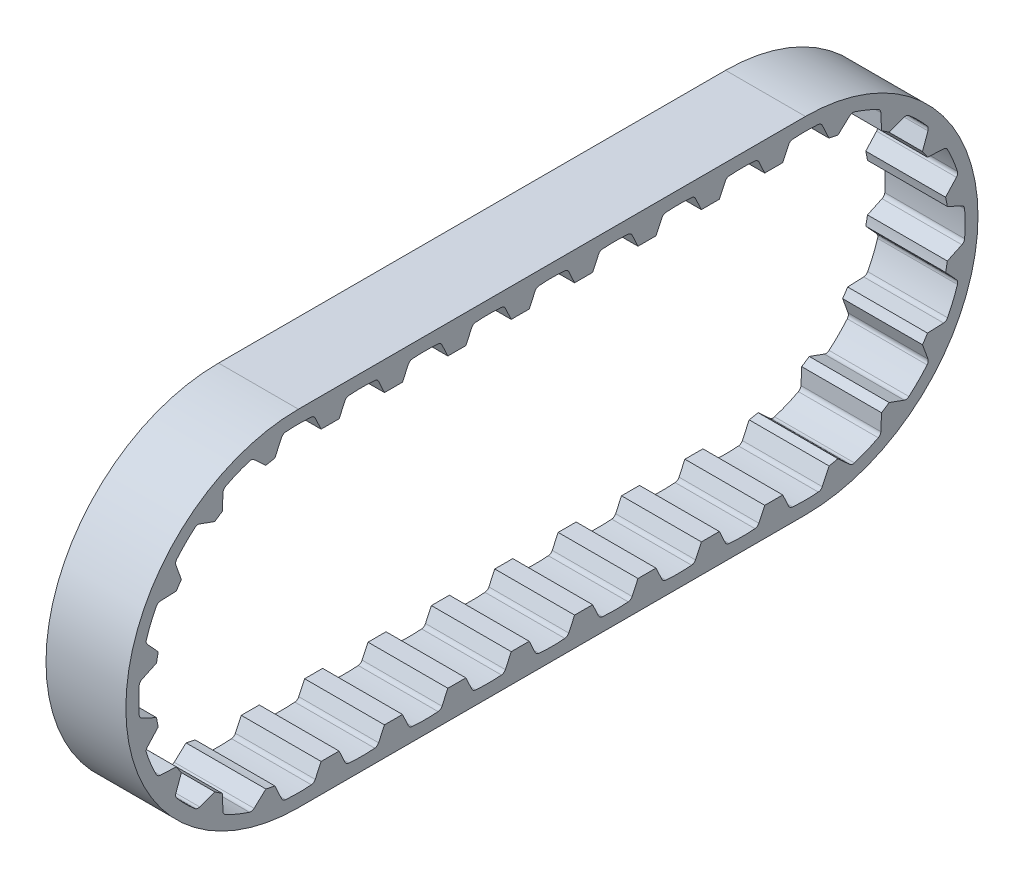
from build123d import *

# Parameters (mm, degrees)
SKETCH_2_W            = 6.4
SKETCH_2_H            = 2.3
CUT_EXTRUDE_1_DEPTH   = 57.290553399
PATTERN_START         = -3.2
PATTERN_CURVE_1_DEPTH = 6.4


# Read off the part's stored shape, not the designer's step: 曲线阵列1
with BuildPart() as part:
    # 扫描1: sweep along a path in 草图1
    with BuildLine(Plane(origin=(0, 0, 0), x_dir=(0, 0, -1), z_dir=(1, 0, 0))) as sweep_1_path:
        Line((0, 13.831), (40.64, 13.831))
        ThreePointArc((40.64, 13.831), (54.471, 0), (40.64, -13.831))
        Line((40.64, -13.831), (0, -13.831))
        ThreePointArc((0, -13.831), (-13.831, 0), (0, 13.831))
    # 草图2 → 扫描1 (sweep)
    with BuildSketch(Plane.XY):
        with Locations((0, 12.681)):
            Rectangle(SKETCH_2_W, SKETCH_2_H)
    sweep(path=sweep_1_path.line)

    # 草图3 → 切除-拉伸1 (cut, symmetric)
    with BuildSketch(Plane(origin=(0, 0, 0), x_dir=(0, 0, -1), z_dir=(1, 0, 0))):
        with BuildLine():
            Line((-12.541026384, 1.347471358), (-7.781, 3.567108114))
            Line((-7.781, 3.567108114), (-7.781, -3.567108114))
            Line((-7.781, -3.567108114), (-12.541026384, -1.347471358))
            ThreePointArc((-12.541026384, -1.347471358), (-12.692407492, -1.220032795), (-12.759190316, -1.033761805))
            ThreePointArc((-12.759190316, -1.033761805), (-12.801, 0), (-12.759190316, 1.033761805))
            ThreePointArc((-12.759190316, 1.033761805), (-12.692407492, 1.220032795), (-12.541026384, 1.347471358))
        make_face()
    extrude(amount=CUT_EXTRUDE_1_DEPTH, both=True, mode=Mode.SUBTRACT)

    # 曲线阵列1 outline → 曲线阵列1 (cut)
    with BuildSketch(Plane.YZ.offset(PATTERN_START)):
        with BuildLine():
            ThreePointArc((6.0443314, 11.07064044), (5.984527751, 11.259267985), (5.837994725, 11.392252569))
            ThreePointArc((5.837994725, 11.392252569), (4.898930567, 11.826499072), (3.927865356, 12.183491895))
            ThreePointArc((3.927865356, 12.183491895), (3.730216882, 12.193078774), (3.55454642, 12.101992463))
            Line((3.55454642, 12.101992463), (2.605846728, 11.232698867))
            ThreePointArc((2.605846728, 11.232698867), (4.41290277, 10.653180283), (6.100436521, 9.78512316))
            Line((6.100436521, 9.78512316), (6.0443314, 11.07064044))
        make_face()
        with BuildLine():
            Line((-6.0443314, 11.07064044), (-6.100436521, 9.78512316))
            ThreePointArc((-6.100436521, 9.78512316), (-4.41290277, 10.653180283), (-2.605846728, 11.232698867))
            Line((-2.605846728, 11.232698867), (-3.55454642, 12.101992463))
            ThreePointArc((-3.55454642, 12.101992463), (-3.730216882, 12.193078774), (-3.927865356, 12.183491895))
            ThreePointArc((-3.927865356, 12.183491895), (-4.898930567, 11.826499072), (-5.837994725, 11.392252569))
            ThreePointArc((-5.837994725, 11.392252569), (-5.984527751, 11.259267985), (-6.0443314, 11.07064044))
        make_face()
        with BuildLine():
            Line((-9.820918564, 7.914706589), (-9.380786329, 6.705580426))
            ThreePointArc((-9.380786329, 6.705580426), (-8.153923993, 8.153372585), (-6.706214806, 9.380332829))
            Line((-6.706214806, 9.380332829), (-7.915370731, 9.820383292))
            ThreePointArc((-7.915370731, 9.820383292), (-8.112526584, 9.837306562), (-8.291459795, 9.752809619))
            ThreePointArc((-8.291459795, 9.752809619), (-9.05197997, 9.051367832), (-9.753370324, 8.290800222))
            ThreePointArc((-9.753370324, 8.290800222), (-9.837855166, 8.111861297), (-9.820918564, 7.914706589))
        make_face()
        with BuildLine():
            Line((-12.102232819, 3.553727989), (-11.232875067, 2.605087087))
            ThreePointArc((-11.232875067, 2.605087087), (-10.65347869, 4.412182317), (-9.785535692, 6.099774768))
            Line((-9.785535692, 6.099774768), (-11.071049175, 6.043582711))
            ThreePointArc((-11.071049175, 6.043582711), (-11.259672676, 5.983766306), (-11.39264735, 5.837224286))
            ThreePointArc((-11.39264735, 5.837224286), (-11.826830346, 4.898130763), (-12.183757497, 3.927041412))
            ThreePointArc((-12.183757497, 3.927041412), (-12.19333101, 3.729392291), (-12.102232819, 3.553727989))
        make_face()
        with BuildLine():
            Line((-12.541026384, -1.348346114), (-11.531, -1.819329152))
            Line((-11.531, -1.819329152), (-11.531, 0))
            ThreePointArc((-11.531, 0), (-11.491933973, 0.948374689), (-11.375000598, 1.890323355))
            Line((-11.375000598, 1.890323355), (-12.541026384, 1.346596601))
            ThreePointArc((-12.541026384, 1.346596601), (-12.692407492, 1.219158038), (-12.759190316, 1.032887048))
            ThreePointArc((-12.759190316, 1.032887048), (-12.801, -0.000874757), (-12.759190316, -1.034636561))
            ThreePointArc((-12.759190316, -1.034636561), (-12.692407492, -1.220907551), (-12.541026384, -1.348346114))
        make_face()
        with BuildLine():
            Line((-12.541026384, -6.428127425), (-11.531, -6.899110463))
            Line((-11.531, -6.899110463), (-11.531, -3.262201672))
            Line((-11.531, -3.262201672), (-12.541026384, -3.73318471))
            ThreePointArc((-12.541026384, -3.73318471), (-12.692407492, -3.860623273), (-12.759190316, -4.046894263))
            ThreePointArc((-12.759190316, -4.046894263), (-12.801, -5.080656067), (-12.759190316, -6.114417872))
            ThreePointArc((-12.759190316, -6.114417872), (-12.692407492, -6.300688862), (-12.541026384, -6.428127425))
        make_face()
        with BuildLine():
            Line((-12.541026384, -11.507908736), (-11.531, -11.978891774))
            Line((-11.531, -11.978891774), (-11.531, -8.341982983))
            Line((-11.531, -8.341982983), (-12.541026384, -8.81296602))
            ThreePointArc((-12.541026384, -8.81296602), (-12.692407492, -8.940404583), (-12.759190316, -9.126675573))
            ThreePointArc((-12.759190316, -9.126675573), (-12.801, -10.160437378), (-12.759190316, -11.194199183))
            ThreePointArc((-12.759190316, -11.194199183), (-12.692407492, -11.380470173), (-12.541026384, -11.507908736))
        make_face()
        with BuildLine():
            Line((-12.541026384, -16.587690047), (-11.531, -17.058673085))
            Line((-11.531, -17.058673085), (-11.531, -13.421764294))
            Line((-11.531, -13.421764294), (-12.541026384, -13.892747331))
            ThreePointArc((-12.541026384, -13.892747331), (-12.692407492, -14.020185894), (-12.759190316, -14.206456884))
            ThreePointArc((-12.759190316, -14.206456884), (-12.801, -15.240218689), (-12.759190316, -16.273980494))
            ThreePointArc((-12.759190316, -16.273980494), (-12.692407492, -16.460251484), (-12.541026384, -16.587690047))
        make_face()
        with BuildLine():
            Line((-12.541026384, -21.667471358), (-11.531, -22.138454396))
            Line((-11.531, -22.138454396), (-11.531, -18.501545604))
            Line((-11.531, -18.501545604), (-12.541026384, -18.972528642))
            ThreePointArc((-12.541026384, -18.972528642), (-12.692407492, -19.099967205), (-12.759190316, -19.286238195))
            ThreePointArc((-12.759190316, -19.286238195), (-12.801, -20.32), (-12.759190316, -21.353761805))
            ThreePointArc((-12.759190316, -21.353761805), (-12.692407492, -21.540032795), (-12.541026384, -21.667471358))
        make_face()
        with BuildLine():
            Line((-12.541026384, -26.747252669), (-11.531, -27.218235706))
            Line((-11.531, -27.218235706), (-11.531, -23.581326915))
            Line((-11.531, -23.581326915), (-12.541026384, -24.052309953))
            ThreePointArc((-12.541026384, -24.052309953), (-12.692407492, -24.179748516), (-12.759190316, -24.366019506))
            ThreePointArc((-12.759190316, -24.366019506), (-12.801, -25.399781311), (-12.759190316, -26.433543116))
            ThreePointArc((-12.759190316, -26.433543116), (-12.692407492, -26.619814106), (-12.541026384, -26.747252669))
        make_face()
        with BuildLine():
            Line((-12.541026384, -31.82703398), (-11.531, -32.298017017))
            Line((-11.531, -32.298017017), (-11.531, -28.661108226))
            Line((-11.531, -28.661108226), (-12.541026384, -29.132091264))
            ThreePointArc((-12.541026384, -29.132091264), (-12.692407492, -29.259529827), (-12.759190316, -29.445800817))
            ThreePointArc((-12.759190316, -29.445800817), (-12.801, -30.479562622), (-12.759190316, -31.513324427))
            ThreePointArc((-12.759190316, -31.513324427), (-12.692407492, -31.699595417), (-12.541026384, -31.82703398))
        make_face()
        with BuildLine():
            Line((-12.541026384, -36.90681529), (-11.531, -37.377798328))
            Line((-11.531, -37.377798328), (-11.531, -33.740889537))
            Line((-11.531, -33.740889537), (-12.541026384, -34.211872575))
            ThreePointArc((-12.541026384, -34.211872575), (-12.692407492, -34.339311138), (-12.759190316, -34.525582128))
            ThreePointArc((-12.759190316, -34.525582128), (-12.801, -35.559343932), (-12.759190316, -36.593105737))
            ThreePointArc((-12.759190316, -36.593105737), (-12.692407492, -36.779376727), (-12.541026384, -36.90681529))
        make_face()
        with BuildLine():
            Line((-12.541026384, -41.986596601), (-11.375000598, -42.530323355))
            ThreePointArc((-11.375000598, -42.530323355), (-11.491933973, -41.588374689), (-11.531, -40.64))
            Line((-11.531, -40.64), (-11.531, -38.820670848))
            Line((-11.531, -38.820670848), (-12.541026384, -39.291653886))
            ThreePointArc((-12.541026384, -39.291653886), (-12.692407492, -39.419092449), (-12.759190316, -39.605363439))
            ThreePointArc((-12.759190316, -39.605363439), (-12.801, -40.639125243), (-12.759190316, -41.672887048))
            ThreePointArc((-12.759190316, -41.672887048), (-12.692407492, -41.859158038), (-12.541026384, -41.986596601))
        make_face()
        with BuildLine():
            Line((-11.071049175, -46.683582711), (-9.785535692, -46.739774768))
            ThreePointArc((-9.785535692, -46.739774768), (-10.65347869, -45.052182317), (-11.232875067, -43.245087087))
            Line((-11.232875067, -43.245087087), (-12.102232819, -44.193727989))
            ThreePointArc((-12.102232819, -44.193727989), (-12.19333101, -44.369392291), (-12.183757497, -44.567041412))
            ThreePointArc((-12.183757497, -44.567041412), (-11.826830346, -45.538130763), (-11.39264735, -46.477224286))
            ThreePointArc((-11.39264735, -46.477224286), (-11.259672676, -46.623766306), (-11.071049175, -46.683582711))
        make_face()
        with BuildLine():
            Line((-7.915370731, -50.460383292), (-6.706214806, -50.020332829))
            ThreePointArc((-6.706214806, -50.020332829), (-8.153923993, -48.793372586), (-9.380786329, -47.345580426))
            Line((-9.380786329, -47.345580426), (-9.820918564, -48.554706589))
            ThreePointArc((-9.820918564, -48.554706589), (-9.837855166, -48.751861297), (-9.753370324, -48.930800222))
            ThreePointArc((-9.753370324, -48.930800222), (-9.05197997, -49.691367832), (-8.291459795, -50.392809619))
            ThreePointArc((-8.291459795, -50.392809619), (-8.112526584, -50.477306562), (-7.915370731, -50.460383292))
        make_face()
        with BuildLine():
            Line((-3.55454642, -52.741992463), (-2.605846728, -51.872698867))
            ThreePointArc((-2.605846728, -51.872698867), (-4.41290277, -51.293180283), (-6.100436521, -50.42512316))
            Line((-6.100436521, -50.42512316), (-6.0443314, -51.71064044))
            ThreePointArc((-6.0443314, -51.71064044), (-5.984527751, -51.899267985), (-5.837994725, -52.032252569))
            ThreePointArc((-5.837994725, -52.032252569), (-4.898930567, -52.466499072), (-3.927865356, -52.823491895))
            ThreePointArc((-3.927865356, -52.823491895), (-3.730216882, -52.833078774), (-3.55454642, -52.741992463))
        make_face()
        with BuildLine():
            Line((1.347471358, -53.181026384), (1.891271613, -52.014842974))
            ThreePointArc((1.891271613, -52.014842974), (0, -52.171), (-1.891271613, -52.014842974))
            Line((-1.891271613, -52.014842974), (-1.347471358, -53.181026384))
            ThreePointArc((-1.347471358, -53.181026384), (-1.220032795, -53.332407492), (-1.033761805, -53.399190316))
            ThreePointArc((-1.033761805, -53.399190316), (0, -53.441), (1.033761805, -53.399190316))
            ThreePointArc((1.033761805, -53.399190316), (1.220032795, -53.332407492), (1.347471358, -53.181026384))
        make_face()
        with BuildLine():
            Line((6.0443314, -51.71064044), (6.100436521, -50.42512316))
            ThreePointArc((6.100436521, -50.42512316), (4.41290277, -51.293180283), (2.605846728, -51.872698867))
            Line((2.605846728, -51.872698867), (3.55454642, -52.741992463))
            ThreePointArc((3.55454642, -52.741992463), (3.730216882, -52.833078774), (3.927865356, -52.823491895))
            ThreePointArc((3.927865356, -52.823491895), (4.898930567, -52.466499072), (5.837994725, -52.032252569))
            ThreePointArc((5.837994725, -52.032252569), (5.984527751, -51.899267985), (6.0443314, -51.71064044))
        make_face()
        with BuildLine():
            Line((9.820918564, -48.554706589), (9.380786329, -47.345580426))
            ThreePointArc((9.380786329, -47.345580426), (8.153923993, -48.793372586), (6.706214806, -50.020332829))
            Line((6.706214806, -50.020332829), (7.915370731, -50.460383292))
            ThreePointArc((7.915370731, -50.460383292), (8.112526584, -50.477306562), (8.291459795, -50.392809619))
            ThreePointArc((8.291459795, -50.392809619), (9.05197997, -49.691367832), (9.753370324, -48.930800222))
            ThreePointArc((9.753370324, -48.930800222), (9.837855166, -48.751861297), (9.820918564, -48.554706589))
        make_face()
        with BuildLine():
            Line((12.102232819, -44.193727989), (11.232875067, -43.245087087))
            ThreePointArc((11.232875067, -43.245087087), (10.65347869, -45.052182317), (9.785535692, -46.739774768))
            Line((9.785535692, -46.739774768), (11.071049175, -46.683582711))
            ThreePointArc((11.071049175, -46.683582711), (11.259672676, -46.623766306), (11.39264735, -46.477224286))
            ThreePointArc((11.39264735, -46.477224286), (11.826830346, -45.538130763), (12.183757497, -44.567041412))
            ThreePointArc((12.183757497, -44.567041412), (12.19333101, -44.369392291), (12.102232819, -44.193727989))
        make_face()
        with BuildLine():
            Line((12.541026384, -39.291653886), (11.531, -38.820670848))
            Line((11.531, -38.820670848), (11.531, -40.64))
            ThreePointArc((11.531, -40.64), (11.491933973, -41.588374689), (11.375000598, -42.530323355))
            Line((11.375000598, -42.530323355), (12.541026384, -41.986596601))
            ThreePointArc((12.541026384, -41.986596601), (12.692407492, -41.859158038), (12.759190316, -41.672887048))
            ThreePointArc((12.759190316, -41.672887048), (12.801, -40.639125244), (12.759190316, -39.605363439))
            ThreePointArc((12.759190316, -39.605363439), (12.692407492, -39.419092449), (12.541026384, -39.291653886))
        make_face()
        with BuildLine():
            Line((12.541026384, -34.211872575), (11.531, -33.740889537))
            Line((11.531, -33.740889537), (11.531, -37.377798328))
            Line((11.531, -37.377798328), (12.541026384, -36.90681529))
            ThreePointArc((12.541026384, -36.90681529), (12.692407492, -36.779376727), (12.759190316, -36.593105737))
            ThreePointArc((12.759190316, -36.593105737), (12.801, -35.559343933), (12.759190316, -34.525582128))
            ThreePointArc((12.759190316, -34.525582128), (12.692407492, -34.339311138), (12.541026384, -34.211872575))
        make_face()
        with BuildLine():
            Line((12.541026384, -29.132091264), (11.531, -28.661108226))
            Line((11.531, -28.661108226), (11.531, -32.298017017))
            Line((11.531, -32.298017017), (12.541026384, -31.82703398))
            ThreePointArc((12.541026384, -31.82703398), (12.692407492, -31.699595417), (12.759190316, -31.513324427))
            ThreePointArc((12.759190316, -31.513324427), (12.801, -30.479562622), (12.759190316, -29.445800817))
            ThreePointArc((12.759190316, -29.445800817), (12.692407492, -29.259529827), (12.541026384, -29.132091264))
        make_face()
        with BuildLine():
            Line((12.541026384, -24.052309953), (11.531, -23.581326915))
            Line((11.531, -23.581326915), (11.531, -27.218235706))
            Line((11.531, -27.218235706), (12.541026384, -26.747252669))
            ThreePointArc((12.541026384, -26.747252669), (12.692407492, -26.619814106), (12.759190316, -26.433543116))
            ThreePointArc((12.759190316, -26.433543116), (12.801, -25.399781311), (12.759190316, -24.366019506))
            ThreePointArc((12.759190316, -24.366019506), (12.692407492, -24.179748516), (12.541026384, -24.052309953))
        make_face()
        with BuildLine():
            Line((12.541026384, -18.972528642), (11.531, -18.501545604))
            Line((11.531, -18.501545604), (11.531, -22.138454396))
            Line((11.531, -22.138454396), (12.541026384, -21.667471358))
            ThreePointArc((12.541026384, -21.667471358), (12.692407492, -21.540032795), (12.759190316, -21.353761805))
            ThreePointArc((12.759190316, -21.353761805), (12.801, -20.32), (12.759190316, -19.286238195))
            ThreePointArc((12.759190316, -19.286238195), (12.692407492, -19.099967205), (12.541026384, -18.972528642))
        make_face()
        with BuildLine():
            Line((12.541026384, -13.892747331), (11.531, -13.421764294))
            Line((11.531, -13.421764294), (11.531, -17.058673085))
            Line((11.531, -17.058673085), (12.541026384, -16.587690047))
            ThreePointArc((12.541026384, -16.587690047), (12.692407492, -16.460251484), (12.759190316, -16.273980494))
            ThreePointArc((12.759190316, -16.273980494), (12.801, -15.240218689), (12.759190316, -14.206456884))
            ThreePointArc((12.759190316, -14.206456884), (12.692407492, -14.020185894), (12.541026384, -13.892747331))
        make_face()
        with BuildLine():
            Line((12.541026384, -8.81296602), (11.531, -8.341982983))
            Line((11.531, -8.341982983), (11.531, -11.978891774))
            Line((11.531, -11.978891774), (12.541026384, -11.507908736))
            ThreePointArc((12.541026384, -11.507908736), (12.692407492, -11.380470173), (12.759190316, -11.194199183))
            ThreePointArc((12.759190316, -11.194199183), (12.801, -10.160437378), (12.759190316, -9.126675573))
            ThreePointArc((12.759190316, -9.126675573), (12.692407492, -8.940404583), (12.541026384, -8.81296602))
        make_face()
        with BuildLine():
            Line((12.541026384, -3.73318471), (11.531, -3.262201672))
            Line((11.531, -3.262201672), (11.531, -6.899110463))
            Line((11.531, -6.899110463), (12.541026384, -6.428127425))
            ThreePointArc((12.541026384, -6.428127425), (12.692407492, -6.300688862), (12.759190316, -6.114417872))
            ThreePointArc((12.759190316, -6.114417872), (12.801, -5.080656067), (12.759190316, -4.046894263))
            ThreePointArc((12.759190316, -4.046894263), (12.692407492, -3.860623273), (12.541026384, -3.73318471))
        make_face()
        with BuildLine():
            Line((12.541026384, 1.346596601), (11.375000598, 1.890323355))
            ThreePointArc((11.375000598, 1.890323355), (11.491933973, 0.948374689), (11.531, 0))
            Line((11.531, 0), (11.531, -1.819329152))
            Line((11.531, -1.819329152), (12.541026384, -1.348346114))
            ThreePointArc((12.541026384, -1.348346114), (12.692407492, -1.220907551), (12.759190316, -1.034636561))
            ThreePointArc((12.759190316, -1.034636561), (12.801, -0.000874756), (12.759190316, 1.032887048))
            ThreePointArc((12.759190316, 1.032887048), (12.692407492, 1.219158038), (12.541026384, 1.346596601))
        make_face()
        with BuildLine():
            Line((11.071049175, 6.043582711), (9.785535692, 6.099774768))
            ThreePointArc((9.785535692, 6.099774768), (10.65347869, 4.412182317), (11.232875067, 2.605087087))
            Line((11.232875067, 2.605087087), (12.102232819, 3.553727989))
            ThreePointArc((12.102232819, 3.553727989), (12.19333101, 3.729392291), (12.183757497, 3.927041412))
            ThreePointArc((12.183757497, 3.927041412), (11.826830346, 4.898130763), (11.39264735, 5.837224286))
            ThreePointArc((11.39264735, 5.837224286), (11.259672676, 5.983766306), (11.071049175, 6.043582711))
        make_face()
        with BuildLine():
            Line((7.915370731, 9.820383292), (6.706214806, 9.380332829))
            ThreePointArc((6.706214806, 9.380332829), (8.153923993, 8.153372585), (9.380786329, 6.705580426))
            Line((9.380786329, 6.705580426), (9.820918564, 7.914706589))
            ThreePointArc((9.820918564, 7.914706589), (9.837855166, 8.111861297), (9.753370324, 8.290800222))
            ThreePointArc((9.753370324, 8.290800222), (9.05197997, 9.051367832), (8.291459795, 9.752809619))
            ThreePointArc((8.291459795, 9.752809619), (8.112526584, 9.837306562), (7.915370731, 9.820383292))
        make_face()
    extrude(amount=PATTERN_CURVE_1_DEPTH, mode=Mode.SUBTRACT)


solid = part.part
